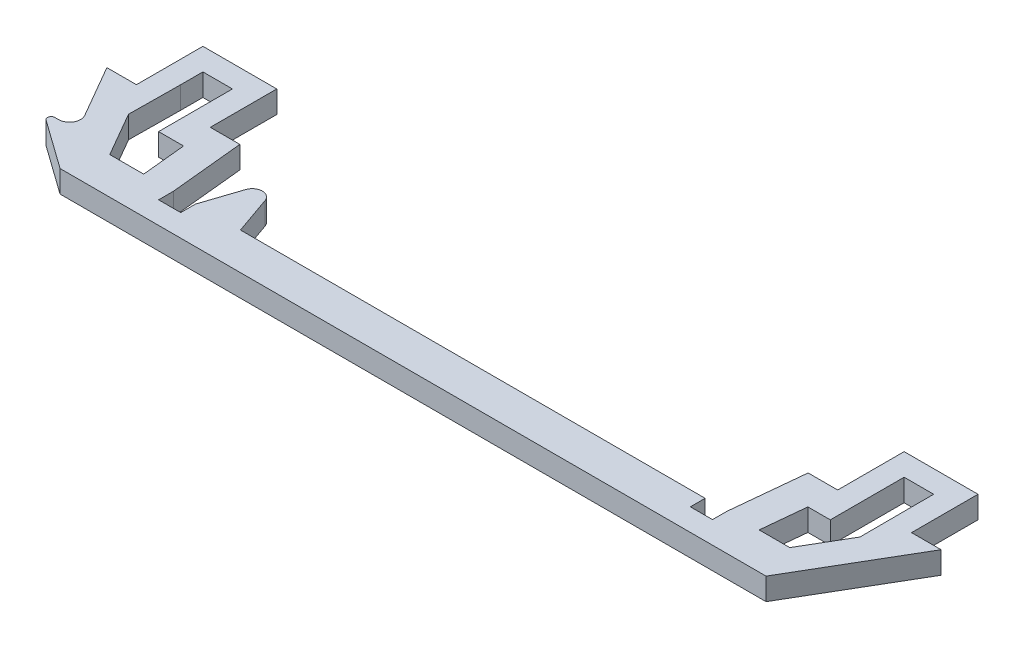
from build123d import *

# Parameters (mm, degrees)
BOSS_EXTRUDE1_DEPTH = 3


with BuildPart() as part:
    # Sketch1 → Boss-Extrude1 (new body)
    with BuildSketch(Plane(origin=(0, 0, 0), x_dir=(1, 0, 0), z_dir=(0, 1, 0))):
        with BuildLine():
            Line((-62.418566214, -47.1586621), (-58.418566214, -47.1586621))
            Line((-58.418566214, -47.1586621), (-58.418566214, -38.1586621))
            Line((-58.418566214, -38.1586621), (-48.418566214, -38.1586621))
            Line((-48.418566214, -38.1586621), (-48.418566214, -47.1586621))
            Line((-48.418566214, -47.1586621), (-44.418566214, -47.1586621))
            Line((-44.418566214, -47.1586621), (-43.418817081, -57.156153425))
            Line((-43.418817081, -57.156153425), (-43.418817081, -59.1586621))
            Line((-43.418817081, -59.1586621), (-40.418817081, -59.1586621))
            Line((-40.418817081, -59.1586621), (-40.418817081, -57.1586621))
            Line((-40.418817081, -57.1586621), (-38.722684913, -52.044656797))
            ThreePointArc((-38.722684913, -52.044656797), (-37.43326006, -51.106013311), (-36.129099744, -52.024073178))
            Line((-36.129099744, -52.024073178), (-34.335191263, -57.1586621))
            Line((-34.335191263, -57.1586621), (28.581433786, -57.1586621))
            Line((28.581433786, -57.1586621), (28.581433786, -59.1586621))
            Line((28.581433786, -59.1586621), (31.581433786, -59.1586621))
            Line((31.581433786, -59.1586621), (31.581433786, -57.208800497))
            Line((31.581433786, -57.208800497), (32.581433786, -47.211334262))
            Line((32.581433786, -47.211334262), (36.581433786, -47.211334262))
            Line((36.581433786, -47.211334262), (36.581433786, -38.211334262))
            Line((36.581433786, -38.211334262), (46.581433786, -38.211334262))
            Line((46.581433786, -38.211334262), (46.581433786, -47.211334262))
            Line((46.581433786, -47.211334262), (50.581433786, -47.211334262))
            Line((50.581433786, -47.211334262), (41.830582941, -62.1586621))
            Line((41.830582941, -62.1586621), (-53.758312176, -62.1586621))
            Line((-53.758312176, -62.1586621), (-60.382083638, -57.430990881))
            ThreePointArc((-60.382083638, -57.430990881), (-60.567785948, -56.871516574), (-60.091610782, -56.524019727))
            Line((-60.091610782, -56.524019727), (-59.609550678, -56.524019727))
            ThreePointArc((-59.609550678, -56.524019727), (-58.310512573, -55.774019727), (-58.310512573, -54.274019727))
            Line((-58.310512573, -54.274019727), (-62.418566214, -47.1586621))
        make_face()
        Polygon((36.547763078, -51.211334262), (39.581433786, -51.211334262), (39.581433786, -44.211334262), (39.581433786, -41.211334262), (43.581433786, -41.211334262), (43.581433786, -44.211334262), (43.604572315, -51.211334262), (40.093380681, -57.208800497), (35.947864455, -57.208800497), align=None, mode=Mode.SUBTRACT)
        Polygon((-55.418566214, -41.1586621), (-51.418566214, -41.1586621), (-51.418566214, -44.1586621), (-51.418566214, -51.1586621), (-48.038516462, -51.1586621), (-47.438516462, -57.1586621), (-52.026261368, -57.1586621), (-55.490362984, -51.1586621), (-55.418566214, -44.1586621), align=None, mode=Mode.SUBTRACT)
    extrude(amount=BOSS_EXTRUDE1_DEPTH)


solid = part.part
